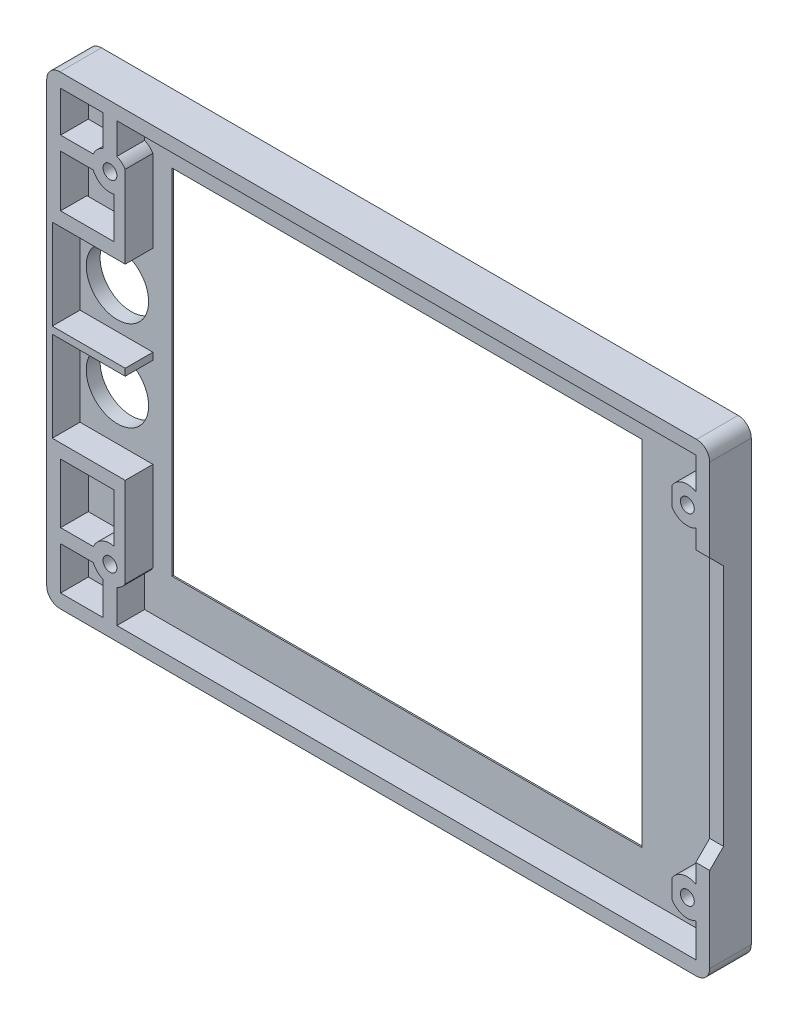
from build123d import *

# Parameters (mm, degrees)
SKETCH_2_R          = 4.5
SKETCH_2_W          = 67.8
SKETCH_2_H          = 51
EXTRUDE_1_DEPTH     = 2
SKETCH_3_R          = 1
EXTRUDE_2_DEPTH     = 4
SKETCH_4_W          = 7.723167142
SKETCH_4_H          = 2
SKETCH_4_W_2        = 2
SKETCH_4_H_2        = 9
SKETCH_4_H_3        = 10
EXTRUDE_3_DEPTH     = 3.8
CUT_EXTRUDE_1_DEPTH = 2
CHAMFER_2_SIZE      = 2
SKETCH_6_W          = 78.903110185
SKETCH_6_H          = 60.07500003
CUT_EXTRUDE_2_DEPTH = 4
CHAMFER_3_SIZE      = 1.8


with BuildPart() as part:
    # Эскиз2 → Бобышка-Вытянуть1 (new body)
    with BuildSketch(Plane.XY):
        with BuildLine():
            Line((-47.825, 31.6375), (-47.825, -31.6375))
            ThreePointArc((-47.825, -31.6375), (-47.268502884, -32.981002884), (-45.925, -33.5375))
            Line((-45.925, -33.5375), (45.925, -33.5375))
            ThreePointArc((45.925, -33.5375), (47.268502884, -32.981002884), (47.825, -31.6375))
            Line((47.825, -31.6375), (47.825, -19.36863872))
            Line((47.825, -19.36863872), (47.825, -17.36863872))
            Line((47.825, -17.36863872), (47.825, 17.677620675))
            Line((47.825, 17.677620675), (47.825, 19.677620675))
            Line((47.825, 19.677620675), (47.825, 31.6375))
            ThreePointArc((47.825, 31.6375), (47.268502884, 32.981002884), (45.925, 33.5375))
            Line((45.925, 33.5375), (-45.925, 33.5375))
            ThreePointArc((-45.925, 33.5375), (-47.268502884, 32.981002884), (-47.825, 31.6375))
        make_face()
        with Locations((-41.625, 7.212805211)):
            Circle(SKETCH_2_R, mode=Mode.SUBTRACT)
        with Locations((-41.625, -5.794271444)):
            Circle(SKETCH_2_R, mode=Mode.SUBTRACT)
        with Locations((0.165, 0.106266667)):
            Rectangle(SKETCH_2_W, SKETCH_2_H, mode=Mode.SUBTRACT)
    extrude(amount=EXTRUDE_1_DEPTH)

    # Эскиз3 → Бобышка-Вытянуть2 (add)
    with BuildSketch(Plane.XY.offset(2)):
        with BuildLine():
            ThreePointArc((47.825, 31.6375), (47.268502884, 32.981002884), (45.925, 33.5375))
            Line((45.925, 33.5375), (-45.925, 33.5375))
            ThreePointArc((-45.925, 33.5375), (-47.268502884, 32.981002884), (-47.825, 31.6375))
            Line((-47.825, 31.6375), (-47.825, -31.6375))
            ThreePointArc((-47.825, -31.6375), (-47.268502884, -32.981002884), (-45.925, -33.5375))
            Line((-45.925, -33.5375), (45.925, -33.5375))
            ThreePointArc((45.925, -33.5375), (47.268502884, -32.981002884), (47.825, -31.6375))
            Line((47.825, -31.6375), (47.825, 31.6375))
        make_face()
        with BuildLine():
            ThreePointArc((-41.101832747, -25.36863872), (-40.540310378, -26.207116351), (-39.701832747, -26.76863872))
            Line((-39.701832747, -26.76863872), (-39.701832747, -31.5375))
            Line((-39.701832747, -31.5375), (-45.825, -31.5375))
            Line((-45.825, -31.5375), (-45.825, -25.36863872))
            Line((-45.825, -25.36863872), (-41.101832747, -25.36863872))
        make_face(mode=Mode.SUBTRACT)
        with Locations((-38.701832747, -24.36863872)):
            Circle(SKETCH_3_R, mode=Mode.SUBTRACT)
        with BuildLine():
            ThreePointArc((-37.101832747, -22.319248567), (-39.361609166, -21.853744075), (-41.101832747, -23.36863872))
            Line((-41.101832747, -23.36863872), (-45.825, -23.36863872))
            Line((-45.825, -23.36863872), (-45.825, -13.994271444))
            Line((-45.825, -13.994271444), (-37.101832747, -13.994271444))
            Line((-37.101832747, -13.994271444), (-37.101832747, -22.319248567))
        make_face(mode=Mode.SUBTRACT)
        with Locations((44.601277438, -24.36863872)):
            Circle(SKETCH_3_R, mode=Mode.SUBTRACT)
        with BuildLine():
            Line((-36.101832858, 1.212805211), (-36.501832747, 1.212805211))
            Line((-36.501832747, 1.212805211), (-47.025, 1.212805211))
            Line((-47.025, 1.212805211), (-47.025, 14.212805211))
            Line((-47.025, 14.212805211), (-36.501832747, 14.212805211))
            Line((-36.501832747, 14.212805211), (-36.101832858, 14.212805211))
            Line((-36.101832858, 14.212805211), (-36.101832858, 24.677620706))
            ThreePointArc((-36.101832858, 24.677620706), (-36.538502092, 26.119841216), (-37.701832858, 27.077620706))
            Line((-37.701832858, 27.077620706), (-37.701832858, 31.53750003))
            Line((-37.701832858, 31.53750003), (45.824999889, 31.53750003))
            Line((45.824999889, 31.53750003), (45.824999889, 26.971635329))
            ThreePointArc((45.824999889, 26.971635329), (42.001277327, 24.677620706), (45.824999889, 22.383606083))
            Line((45.824999889, 22.383606083), (45.824999889, 19.677620706))
            Line((45.824999889, 19.677620706), (45.825, 17.677620675))
            Line((45.825, 17.677620675), (45.825, -17.36863872))
            Line((45.825, -17.36863872), (45.825, -19.36863872))
            Line((45.825, -19.36863872), (45.825, -22.074624097))
            ThreePointArc((45.825, -22.074624097), (42.001277438, -24.36863872), (45.825, -26.662653343))
            Line((45.825, -26.662653343), (45.825, -31.5375))
            Line((45.825, -31.5375), (-37.701832747, -31.5375))
            Line((-37.701832747, -31.5375), (-37.701832747, -26.76863872))
            ThreePointArc((-37.701832747, -26.76863872), (-36.538272941, -25.81051562), (-36.101832858, -24.367812827))
            Line((-36.101832858, -24.367812827), (-36.101832858, -12.794271444))
            Line((-36.101832858, -12.794271444), (-36.501832747, -12.794271444))
            Line((-36.501832747, -12.794271444), (-47.025, -12.794271444))
            Line((-47.025, -12.794271444), (-47.025, 0.205728556))
            Line((-47.025, 0.205728556), (-36.501832747, 0.205728556))
            Line((-36.501832747, 0.205728556), (-36.101832858, 0.205728556))
            Line((-36.101832858, 0.205728556), (-36.101832858, 1.212805211))
        make_face(mode=Mode.SUBTRACT)
        with BuildLine():
            Line((-45.825, 15.412805211), (-45.825, 23.677620675))
            Line((-45.825, 23.677620675), (-41.101832747, 23.677620675))
            ThreePointArc((-41.101832747, 23.677620675), (-39.361609166, 22.16272603), (-37.101832747, 22.628230522))
            Line((-37.101832747, 22.628230522), (-37.101832747, 15.412805211))
            Line((-37.101832747, 15.412805211), (-45.825, 15.412805211))
        make_face(mode=Mode.SUBTRACT)
        with Locations((-38.701832747, 24.677620675)):
            Circle(SKETCH_3_R, mode=Mode.SUBTRACT)
        with BuildLine():
            Line((-45.825, 25.677620675), (-45.825, 31.5375))
            Line((-45.825, 31.5375), (-39.701832747, 31.5375))
            Line((-39.701832747, 31.5375), (-39.701832747, 27.077620675))
            ThreePointArc((-39.701832747, 27.077620675), (-40.540310378, 26.516098306), (-41.101832747, 25.677620675))
            Line((-41.101832747, 25.677620675), (-45.825, 25.677620675))
        make_face(mode=Mode.SUBTRACT)
        with Locations((44.601277438, 24.677620675)):
            Circle(SKETCH_3_R, mode=Mode.SUBTRACT)
    extrude(amount=EXTRUDE_2_DEPTH)

    # Эскиз4 → Бобышка-Вытянуть3 (add)
    with BuildSketch(Plane.XY.offset(6)):
        with Locations((-41.963416429, 15.212805211)):
            Rectangle(SKETCH_4_W, SKETCH_4_H)
        with Locations((-37.101832858, 18.712805211)):
            Rectangle(SKETCH_4_W_2, SKETCH_4_H_2)
        with Locations((-41.963416429, -13.794271444)):
            Rectangle(SKETCH_4_W, SKETCH_4_H)
        with Locations((-37.101832858, -17.794271444)):
            Rectangle(SKETCH_4_W_2, SKETCH_4_H_3)
    extrude(amount=-EXTRUDE_3_DEPTH)

    # Эскиз5 → Вырез-Вытянуть1 (cut)
    with BuildSketch(Plane.XY.offset(6)):
        Polygon((47.825, -17.36863872), (47.825, -19.36863872), (45.825, -19.36863872), (45.825, -17.36863872), (45.825, 17.677620675), (45.824999889, 19.677620706), (47.825, 19.677620706), (47.825, 17.677620675), align=None)
    extrude(amount=-CUT_EXTRUDE_1_DEPTH, mode=Mode.SUBTRACT)

    # Фаска2
    chamfer_2_edges = [part.edges().sort_by_distance(p)[0] for p in [
        (46.824999945, 19.677620706, 4),
        (46.825, -19.36863872, 4),
    ]]
    chamfer(chamfer_2_edges, length=CHAMFER_2_SIZE - 0.0001)  # a hair under: the kernel refuses the full size

    # Эскиз6 → Вырез-Вытянуть2 (cut)
    with BuildSketch(Plane.XY.offset(2)):
        with Locations((2.949722235, 0.500000015)):
            Rectangle(SKETCH_6_W, SKETCH_6_H)
    extrude(amount=CUT_EXTRUDE_2_DEPTH, mode=Mode.SUBTRACT)

    # Фаска3
    chamfer_3_edges = [part.edges().sort_by_distance(p)[0] for p in [
        (34.065, 0.106266667, 0),
        (0.165, 25.606266667, 0),
        (-33.735, 0.106266667, 0),
        (0.165, -25.393733333, 0),
    ]]
    chamfer(chamfer_3_edges, length=CHAMFER_3_SIZE)


solid = part.part
